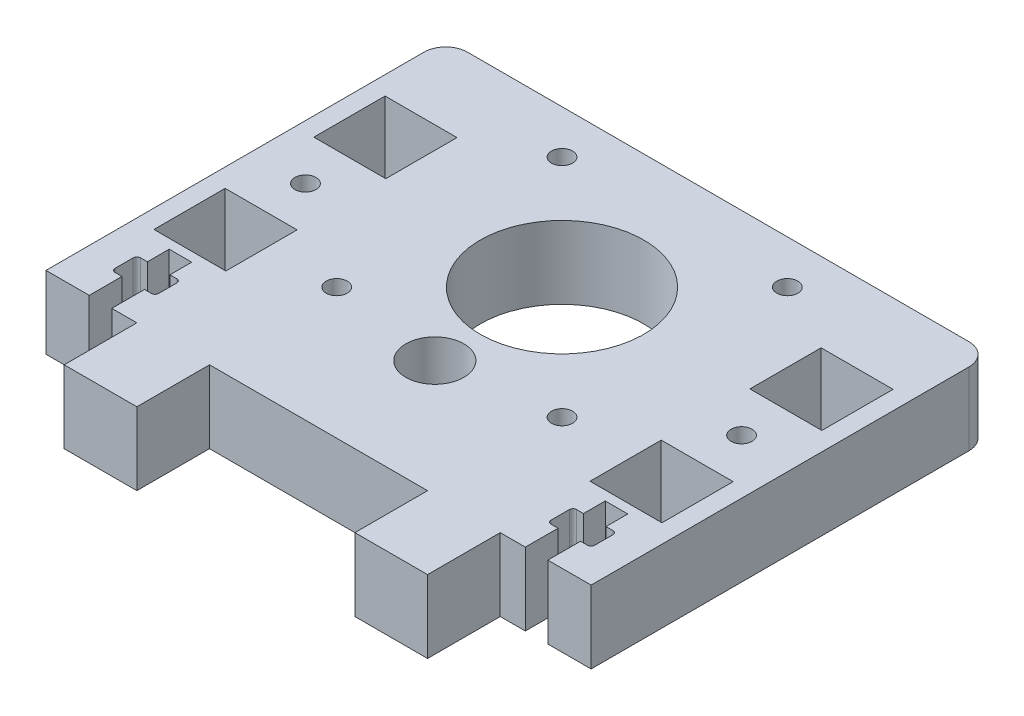
from build123d import *

# Parameters (mm, degrees)
SKETCH1_R        = 1.45
SKETCH1_W        = 9.9
SKETCH1_H        = 9.8
MAINLAYOUT_DEPTH = 10
TSLOT_DEPTH      = 53.936282454


with BuildPart() as part:
    # Sketch1 → MainLayout (new body)
    with BuildSketch(Plane(origin=(0, 0, 0), x_dir=(1, 0, 0), z_dir=(0, 1, 0))):
        with BuildLine():
            Line((-34.5, 29), (0, 29))
            Line((0, 29), (0, 18.75))
            ThreePointArc((0, 18.75), (-11.25, 7.5), (0, -3.75))
            Line((0, -3.75), (0, -6))
            ThreePointArc((0, -6), (-4, -10), (0, -14))
            Line((0, -14), (0, -26))
            Line((0, -26), (-15, -26))
            Line((-15, -26), (-15, -36))
            Line((-15, -36), (-25, -36))
            Line((-25, -36), (-25, -26))
            Line((-25, -26), (-37.5, -26))
            Line((-37.5, -26), (-37.5, 26))
            ThreePointArc((-37.5, 26), (-36.621320344, 28.121320344), (-34.5, 29))
        make_face()
        with Locations((-15.5, 23)):
            Circle(SKETCH1_R, mode=Mode.SUBTRACT)
        with Locations((-15.5, -8)):
            Circle(SKETCH1_R, mode=Mode.SUBTRACT)
        with Locations((-30, 2.2)):
            Circle(SKETCH1_R, mode=Mode.SUBTRACT)
        with Locations((-30, 13.2)):
            Rectangle(SKETCH1_W, SKETCH1_H, mode=Mode.SUBTRACT)
        with Locations((-30, -8.8)):
            Rectangle(SKETCH1_W, SKETCH1_H, mode=Mode.SUBTRACT)
    mainlayout = extrude(amount=MAINLAYOUT_DEPTH)

    # Sketch2 → TSlot (cut, through all)
    with BuildSketch(Plane(origin=(0, 10, 0), x_dir=(1, 0, 0), z_dir=(0, 1, 0))):
        with BuildLine():
            Line((-28.45, -21.5), (-28.45, -26))
            Line((-28.45, -26), (-31.55, -26))
            Line((-31.55, -26), (-31.55, -21.5))
            Line((-31.55, -21.5), (-32.5, -21.5))
            ThreePointArc((-32.5, -21.5), (-32.853553391, -21.353553391), (-33, -21))
            Line((-33, -21), (-33, -18.5))
            ThreePointArc((-33, -18.5), (-32.853553391, -18.146446609), (-32.5, -18))
            Line((-32.5, -18), (-31.55, -18))
            Line((-31.55, -18), (-31.55, -15))
            Line((-31.55, -15), (-28.45, -15))
            Line((-28.45, -15), (-28.45, -18))
            Line((-28.45, -18), (-27.5, -18))
            ThreePointArc((-27.5, -18), (-27.146446609, -18.146446609), (-27, -18.5))
            Line((-27, -18.5), (-27, -21))
            ThreePointArc((-27, -21), (-27.146446609, -21.353553391), (-27.5, -21.5))
            Line((-27.5, -21.5), (-28.45, -21.5))
        make_face()
    tslot = extrude(amount=-TSLOT_DEPTH, mode=Mode.SUBTRACT)

    # Mirror1: MainLayout, TSlot across plane
    add(mainlayout.mirror(Plane(origin=(0, 0, 0), x_dir=(0, 0, 1), z_dir=(1, 0, 0))))
    add(tslot.mirror(Plane(origin=(0, 0, 0), x_dir=(0, 0, 1), z_dir=(1, 0, 0))), mode=Mode.SUBTRACT)


solid = part.part
